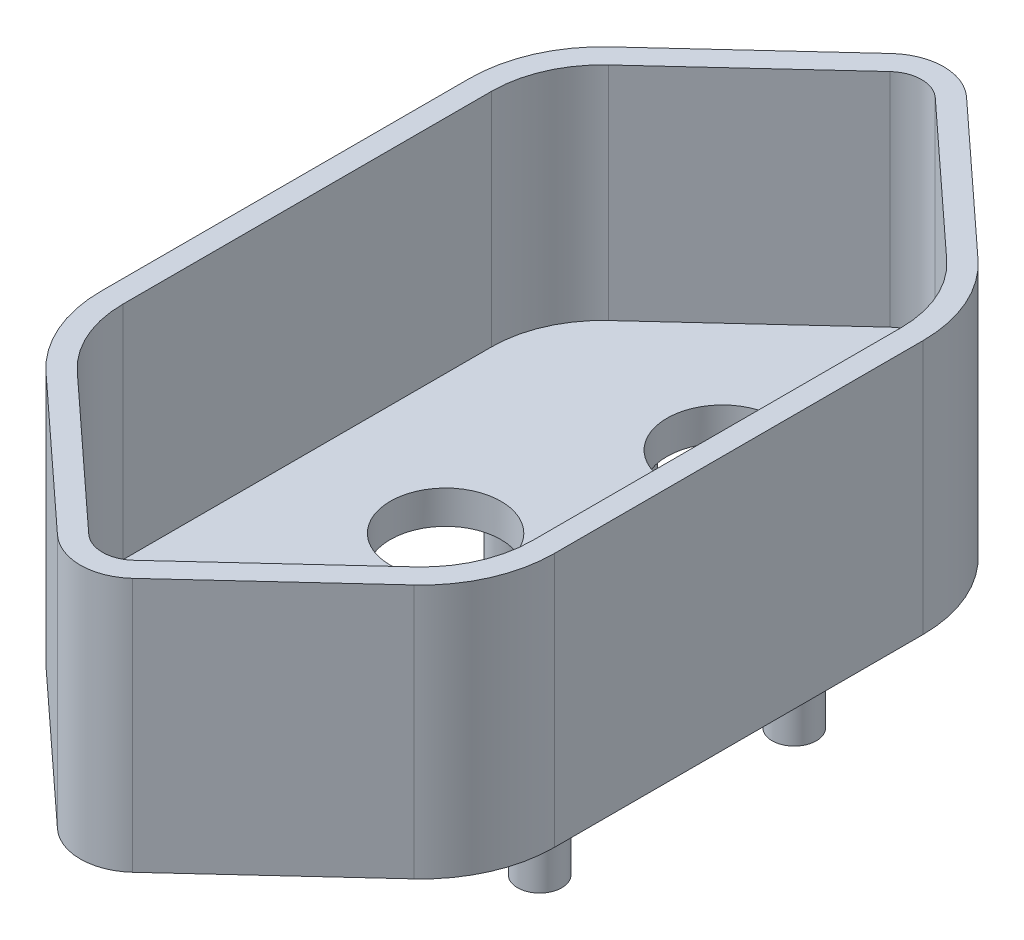
from build123d import *

# Parameters (mm, degrees)
ESBO_O1_W                = 26.7
ESBO_O1_H                = 39.3
RESSALTO_EXTRUS_O1_DEPTH = 38.5
CORTE_EXTRUS_O1_DEPTH    = 10
ESBO_O4_W                = 26.7
ESBO_O4_H                = 39.3
CORTE_EXTRUS_O2_DEPTH    = 10
ESBO_O5_W                = 26.7
ESBO_O5_H                = 39.3
ESBO_O5_W_2              = 22.6
ESBO_O5_H_2              = 27
CORTE_EXTRUS_O4_DEPTH    = 27
ESBO_O6_R                = 2.5
CORTE_EXTRUS_O5_DEPTH    = 5
ESBO_O7_W                = 2.05
ESBO_O7_H                = 1
RESSALTO_EXTRUS_O2_DEPTH = 4
CUT_EXTRUDE1_DEPTH       = 10
CUT_EXTRUDE1_DEPTH_BACK  = 100
SKETCH2_W                = 27
SKETCH2_H                = 27
ESBO_O4_3_W              = 26.7
ESBO_O4_3_H              = 39.3
CUT_EXTRUDE3_DEPTH       = 100
SKETCH6_R                = 1
BOSS_EXTRUDE5_DEPTH      = 4


with BuildPart() as part:
    # Esboço1 → Ressalto-extrusão1 (new body)
    with BuildSketch(Plane(origin=(0, 0, 0), x_dir=(1, 0, 0), z_dir=(0, 1, 0))):
        Rectangle(ESBO_O1_W, ESBO_O1_H)
    extrude(amount=-RESSALTO_EXTRUS_O1_DEPTH)

    # Esboço2 → Corte-extrusão1 (cut)
    with BuildSketch(Plane(origin=(0, 0, 0), x_dir=(1, 0, 0), z_dir=(0, 1, 0))):
        with BuildLine():
            Line((1.016622231, -18.102941176), (7.638740771, -11.999086257))
            ThreePointArc((7.638740771, -11.999086257), (8.829503459, -10.32964035), (9.25, -8.322615669))
            Line((9.25, -8.322615669), (9.25, 8.322615669))
            ThreePointArc((9.25, 8.322615669), (8.829503459, 10.32964035), (7.638740771, 11.999086257))
            Line((7.638740771, 11.999086257), (1.016622231, 18.102941176))
            ThreePointArc((1.016622231, 18.102941176), (0, 18.5), (-1.016622231, 18.102941176))
            Line((-1.016622231, 18.102941176), (-7.638740771, 11.999086257))
            ThreePointArc((-7.638740771, 11.999086257), (-8.829503459, 10.32964035), (-9.25, 8.322615669))
            Line((-9.25, 8.322615669), (-9.25, -8.322615669))
            ThreePointArc((-9.25, -8.322615669), (-8.829503459, -10.32964035), (-7.638740771, -11.999086257))
            Line((-7.638740771, -11.999086257), (-1.016622231, -18.102941176))
            ThreePointArc((-1.016622231, -18.102941176), (0, -18.5), (1.016622231, -18.102941176))
        make_face()
    extrude(amount=-CORTE_EXTRUS_O1_DEPTH, mode=Mode.SUBTRACT)

    # Esboço4 → Corte-extrusão2 (cut)
    with BuildSketch(Plane(origin=(0, 0, 0), x_dir=(1, 0, 0), z_dir=(0, 1, 0))):
        Rectangle(ESBO_O4_W, ESBO_O4_H)
        with BuildLine():
            Line((-1.694370386, -18.838235294), (-8.316488925, -12.734380374))
            ThreePointArc((-8.316488925, -12.734380374), (-9.74540415, -10.731045286), (-10.25, -8.322615669))
            Line((-10.25, -8.322615669), (-10.25, 8.322615669))
            ThreePointArc((-10.25, 8.322615669), (-9.74540415, 10.731045286), (-8.316488925, 12.734380374))
            Line((-8.316488925, 12.734380374), (-1.694370386, 18.838235294))
            ThreePointArc((-1.694370386, 18.838235294), (0, 19.5), (1.694370386, 18.838235294))
            Line((1.694370386, 18.838235294), (8.316488925, 12.734380374))
            ThreePointArc((8.316488925, 12.734380374), (9.74540415, 10.731045286), (10.25, 8.322615669))
            Line((10.25, 8.322615669), (10.25, -8.322615669))
            ThreePointArc((10.25, -8.322615669), (9.74540415, -10.731045286), (8.316488925, -12.734380374))
            Line((8.316488925, -12.734380374), (1.694370386, -18.838235294))
            ThreePointArc((1.694370386, -18.838235294), (0, -19.5), (-1.694370386, -18.838235294))
        make_face(mode=Mode.SUBTRACT)
    extrude(amount=-CORTE_EXTRUS_O2_DEPTH, mode=Mode.SUBTRACT)

    # Esboço5 → Corte-extrusão4 (cut)
    with BuildSketch(Plane.XZ.offset(38.5)):
        Rectangle(ESBO_O5_W, ESBO_O5_H)
        Rectangle(ESBO_O5_W_2, ESBO_O5_H_2, mode=Mode.SUBTRACT)
    extrude(amount=-CORTE_EXTRUS_O4_DEPTH, mode=Mode.SUBTRACT)

    # Esboço6 → Corte-extrusão5 (cut)
    with BuildSketch(Plane(origin=(0, -10, 0), x_dir=(1, 0, 0), z_dir=(0, 1, 0))):
        with Locations((0, -9.5)):
            Circle(ESBO_O6_R)
        with Locations((0, 9.5)):
            Circle(ESBO_O6_R)
        with Locations((-3, 0)):
            Circle(ESBO_O6_R)
    extrude(amount=-CORTE_EXTRUS_O5_DEPTH, mode=Mode.SUBTRACT)

    # Esboço7 → Ressalto-extrusão2 (add)
    with BuildSketch(Plane.XZ.offset(11.5)):
        with Locations((12.325, 13)):
            Rectangle(ESBO_O7_W, ESBO_O7_H)
        with Locations((-12.325, 13)):
            Rectangle(ESBO_O7_W, ESBO_O7_H)
        with Locations((-12.325, -13)):
            Rectangle(ESBO_O7_W, ESBO_O7_H)
        with Locations((12.325, -13)):
            Rectangle(ESBO_O7_W, ESBO_O7_H)
    extrude(amount=RESSALTO_EXTRUS_O2_DEPTH)

    # Sketch2 → Cut-Extrude1 (cut, two sides: drawn at the far end of the back side and taken through both)
    with BuildSketch(Plane(origin=(11.3, 0, 0), x_dir=(0, 0, -1), z_dir=(1, 0, 0)).offset(-CUT_EXTRUDE1_DEPTH_BACK)):
        with Locations((0, -25)):
            Rectangle(SKETCH2_W, SKETCH2_H)
    extrude(amount=CUT_EXTRUDE1_DEPTH + CUT_EXTRUDE1_DEPTH_BACK, mode=Mode.SUBTRACT)

    # Esboço4<3> → Cut-Extrude3 (cut)
    with BuildSketch(Plane(origin=(0, 0, 0), x_dir=(1, 0, 0), z_dir=(0, 1, 0))):
        Rectangle(ESBO_O4_3_W, ESBO_O4_3_H)
        with BuildLine():
            Line((-1.694370386, -18.838235294), (-8.316488925, -12.734380374))
            ThreePointArc((-8.316488925, -12.734380374), (-9.74540415, -10.731045286), (-10.25, -8.322615669))
            Line((-10.25, -8.322615669), (-10.25, 8.322615669))
            ThreePointArc((-10.25, 8.322615669), (-9.74540415, 10.731045286), (-8.316488925, 12.734380374))
            Line((-8.316488925, 12.734380374), (-1.694370386, 18.838235294))
            ThreePointArc((-1.694370386, 18.838235294), (0, 19.5), (1.694370386, 18.838235294))
            Line((1.694370386, 18.838235294), (8.316488925, 12.734380374))
            ThreePointArc((8.316488925, 12.734380374), (9.74540415, 10.731045286), (10.25, 8.322615669))
            Line((10.25, 8.322615669), (10.25, -8.322615669))
            ThreePointArc((10.25, -8.322615669), (9.74540415, -10.731045286), (8.316488925, -12.734380374))
            Line((8.316488925, -12.734380374), (1.694370386, -18.838235294))
            ThreePointArc((1.694370386, -18.838235294), (0, -19.5), (-1.694370386, -18.838235294))
        make_face(mode=Mode.SUBTRACT)
    extrude(amount=-CUT_EXTRUDE3_DEPTH, mode=Mode.SUBTRACT)

    # Sketch6 → Boss-Extrude5 (add)
    with BuildSketch(Plane.XZ.offset(11.5)):
        with Locations((7, -5.75)):
            Circle(SKETCH6_R)
        with Locations((7, 5.75)):
            Circle(SKETCH6_R)
        with Locations((-5.55, 5.7)):
            Circle(SKETCH6_R)
        with Locations((-5.55, 10.7)):
            Circle(SKETCH6_R)
        with Locations((-5.55, -5.7)):
            Circle(SKETCH6_R)
        with Locations((-5.55, -10.7)):
            Circle(SKETCH6_R)
    extrude(amount=BOSS_EXTRUDE5_DEPTH)


solid = part.part
